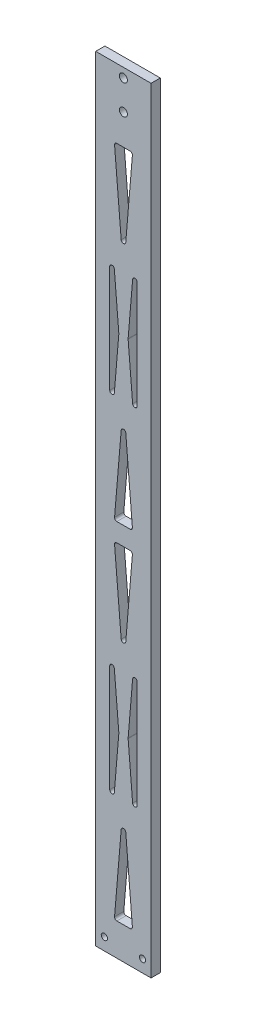
from build123d import *

# Parameters (mm, degrees)
SKETCH1_W           = 38.1
SKETCH1_H           = 533.4
BOSS_EXTRUDE1_DEPTH = 3.175
SKETCH2_R           = 2.778125
CUT_EXTRUDE1_DEPTH  = 294.271022264
CUT_EXTRUDE2_DEPTH  = 294.271022264
FILLET1_R           = 1.5875
SKETCH4_R           = 2.15265
CUT_EXTRUDE3_DEPTH  = 294.271022264


with BuildPart() as part:
    # Sketch1 → Boss-Extrude1 (new, symmetric)
    with BuildSketch(Plane.XY):
        with Locations((-6.35, -25.4)):
            Rectangle(SKETCH1_W, SKETCH1_H)
    extrude(amount=BOSS_EXTRUDE1_DEPTH, both=True)

    # Sketch2 → Cut-Extrude1 (cut, through all)
    with BuildSketch(Plane.XY.offset(3.175)):
        with Locations((-6.35, 234.95)):
            Circle(SKETCH2_R)
        with Locations((-6.35, 214.63)):
            Circle(SKETCH2_R)
    extrude(amount=-CUT_EXTRUDE1_DEPTH, mode=Mode.SUBTRACT)

    # Sketch3 → Cut-Extrude2 (cut, through all)
    with BuildSketch(Plane.XY.offset(3.175)):
        Polygon((-6.291879002, 118.898888525), (-0.011179953, 193.675), (-12.57257805, 193.675), align=None)
        Polygon((3.175, 6.189078026), (3.175, 155.741300976), (-3.105699049, 80.965189501), align=None)
        Polygon((-15.758758004, 6.189078026), (-9.478058955, 80.965189501), (-15.758758004, 155.741300976), align=None)
        Polygon((-0.011179953, -31.744620998), (-6.291879002, 43.031490477), (-12.57257805, -31.744620998), align=None)
        Polygon((3.175, -231.930542972), (3.175, -82.378320022), (-3.105699049, -157.154431497), align=None)
        Polygon((-6.291879002, -119.220732473), (-0.011179953, -44.444620998), (-12.57257805, -44.444620998), align=None)
        Polygon((-9.478058955, -157.154431497), (-15.758758004, -82.378320022), (-15.758758004, -231.930542972), align=None)
        Polygon((-0.011179953, -269.864241996), (-6.291879002, -195.088130521), (-12.57257805, -269.864241996), align=None)
    extrude(amount=-CUT_EXTRUDE2_DEPTH, mode=Mode.SUBTRACT)

    # Fillet1
    fillet1_edges = [part.edges().sort_by_distance(p)[0] for p in [
        (3.175, -82.378320022, 0),
        (-12.57257805, -44.444620998, 0),
        (-0.011179953, -44.444620998, 0),
        (-6.291879002, -119.220732473, 0),
        (-9.478058955, 80.965189501, 0),
        (-15.758758004, 6.189078026, 0),
        (-15.758758004, 155.741300976, 0),
        (3.175, 6.189078026, 0),
        (-3.105699049, 80.965189501, 0),
        (3.175, 155.741300976, 0),
        (3.175, -231.930542972, 0),
        (-3.105699049, -157.154431497, 0),
        (-12.57257805, 193.675, 0),
        (-0.011179953, 193.675, 0),
        (-9.478058955, -157.154431497, 0),
        (-15.758758004, -231.930542972, 0),
        (-15.758758004, -82.378320022, 0),
        (-6.291879002, -195.088130521, 0),
        (-0.011179953, -269.864241996, 0),
        (-12.57257805, -269.864241996, 0),
        (-0.011179953, -31.744620998, 0),
        (-12.57257805, -31.744620998, 0),
        (-6.291879002, 43.031490477, 0),
        (-6.291879002, 118.898888525, 0),
    ]]
    fillet(fillet1_edges, radius=FILLET1_R)

    # Sketch4 → Cut-Extrude3 (cut, through all)
    with BuildSketch(Plane.XY.offset(3.175)):
        with Locations((6.858, -283.591)):
            Circle(SKETCH4_R)
        with Locations((-19.441758004, -283.591)):
            Circle(SKETCH4_R)
    extrude(amount=-CUT_EXTRUDE3_DEPTH, mode=Mode.SUBTRACT)


solid = part.part
